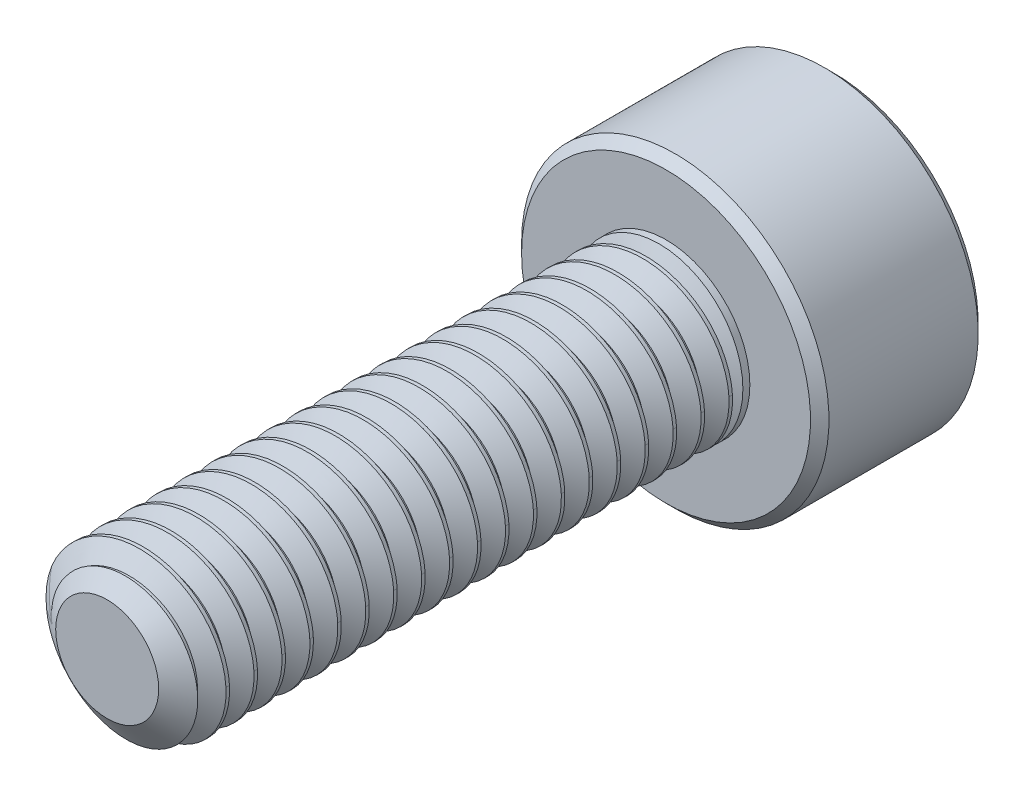
from build123d import *

# Parameters (mm, degrees)
SKETCH1_R          = 1.5
EXTRUDE1_DEPTH     = 10
CUT_SWEEP1_PITCH   = 0.5
SKETCH6_R          = 2.75
EXTRUDE2_DEPTH     = 3
CUT_EXTRUDE1_DEPTH = 1.875
CHAMFER1_SIZE      = 0.165


with BuildPart() as part:
    # Sketch1 → Extrude1 (new body)
    with BuildSketch(Plane.XY):
        Circle(SKETCH1_R)
    extrude(amount=-EXTRUDE1_DEPTH)

    # Cut-Sweep1: arcs per turn and ends read off the stored shape
    # Cut-Sweep1: the profile of Sketch3 profile screwed along a right-hand helix through 23 turns, 6 arcs to a turn; built about Z, then put on its axis
    cut_sweep1_z = Axis((0, 0, 0), (0, 0, 1))
    cut_sweep1_corners = [(1.5003, 0, -0.937673205), (1.175240474, 0, -0.75), (1.175240474, 0, -0.6875), (1.5003, 0, -0.499826795)]
    with BuildLine(mode=Mode.PRIVATE) as cut_sweep1_profile:
        Line(cut_sweep1_corners[0], cut_sweep1_corners[1])
        Line(cut_sweep1_corners[1], cut_sweep1_corners[2])
        Line(cut_sweep1_corners[2], cut_sweep1_corners[3])
        Line(cut_sweep1_corners[3], cut_sweep1_corners[0])
    cut_sweep1_cap = Face(cut_sweep1_profile.wire())
    cut_sweep1_turn_angles = [0, 30, 60, 90, 120, 150, 180, 210, 240, 270, 300, 330, 360]
    cut_sweep1_turn_weights = [1, 0.8660254037844387, 1, 0.8660254037844387, 1, 0.8660254037844387, 1, 0.8660254037844387, 1, 0.8660254037844387, 1, 0.8660254037844387, 1]
    cut_sweep1_turn_rails = [Edge.make_bspline([Vector(p[0], p[1], 0).rotate(cut_sweep1_z, cut_sweep1_turn_angles[k]) / cut_sweep1_turn_weights[k] + Vector(0, 0, p[2] + CUT_SWEEP1_PITCH * cut_sweep1_turn_angles[k] / 360) for k in range(13)], [0, 0, 0, 1, 1, 2, 2, 3, 3, 4, 4, 5, 5, 6, 6, 6], 2, cut_sweep1_turn_weights) for p in cut_sweep1_corners]
    cut_sweep1_turn_sides = [Face.make_surface_from_curves(cut_sweep1_turn_rails[p[0]], cut_sweep1_turn_rails[p[1]]) for p in [(0, 1), (1, 2), (2, 3), (3, 0)]]
    cut_sweep1 = Plane(origin=(0, 0, 0), x_dir=(0, 1, 0), z_dir=(0, 0, -1)) * Solid(Shell([*[p.moved(Location((0, 0, CUT_SWEEP1_PITCH * i))) for i in range(23) for p in cut_sweep1_turn_sides], cut_sweep1_cap, cut_sweep1_cap.rotate(cut_sweep1_z, 8280).moved(Location((0, 0, CUT_SWEEP1_PITCH * 8280 / 360)))]))
    add(cut_sweep1, mode=Mode.SUBTRACT)

    # Sketch4 → Cut-Revolve1 (revolve, cut)
    with BuildSketch(Plane(origin=(0, 0, 0), x_dir=(0, 0, -1), z_dir=(1, 0, 0)), mode=Mode.PRIVATE) as cut_revolve1_sk:
        Polygon((0.405251783, 1.5), (0, 0.921240474), (0, 1.5), align=None)
    revolve(cut_revolve1_sk.sketch.rotate(Axis((0, 0, 0), (0, 0, -1)), 90), axis=Axis((0, 0, 0), (0, 0, -1)), mode=Mode.SUBTRACT)

    # Sketch6 → Extrude2 (add)
    with BuildSketch(Plane(origin=(0, 0, -10), x_dir=(-1, 0, 0), z_dir=(0, 0, -1))):
        Circle(SKETCH6_R)
    extrude(amount=EXTRUDE2_DEPTH)

    # Sketch7 → Cut-Extrude1 (cut)
    with BuildSketch(Plane(origin=(0, 0, -13), x_dir=(-1, 0, 0), z_dir=(0, 0, -1))):
        Polygon((0, 1.443375673), (-1.25, 0.721687836), (-1.25, -0.721687836), (0, -1.443375673), (1.25, -0.721687836), (1.25, 0.721687836), align=None)
    extrude(amount=-CUT_EXTRUDE1_DEPTH, mode=Mode.SUBTRACT)

    # Cut-Extrude2 cone 1 section (through the dimple's axis) → Cut-Extrude2 (revolve, cut)
    with BuildSketch(Plane(origin=(0, 0, -13), x_dir=(0, 1, 0), z_dir=(1, 0, 0))):
        Polygon((0, 0), (1.443375673, 0), (0, 1.443375673), align=None)
    revolve(axis=Axis((0, 0, -13), (0, 0, 1)), mode=Mode.SUBTRACT)

    # Chamfer1
    chamfer1_edges = [part.edges().sort_by_distance(p)[0] for p in [
        (2.75, 0, -10),
        (2.75, 0, -13),
    ]]
    chamfer(chamfer1_edges, length=CHAMFER1_SIZE)

    # Sketch10 → Revolve1 (revolve)
    with BuildSketch(Plane(origin=(0, 0, 0), x_dir=(0, 0, -1), z_dir=(1, 0, 0)), mode=Mode.PRIVATE) as revolve1_sk:
        Polygon((10, 1.5), (10, 0), (9.253679656, 0), (9.875, 1.5), align=None)
    revolve(revolve1_sk.sketch.rotate(Axis((0, 0, -10), (0, 0, 1)), 270), axis=Axis((0, 0, -10), (0, 0, 1)))


solid = part.part
